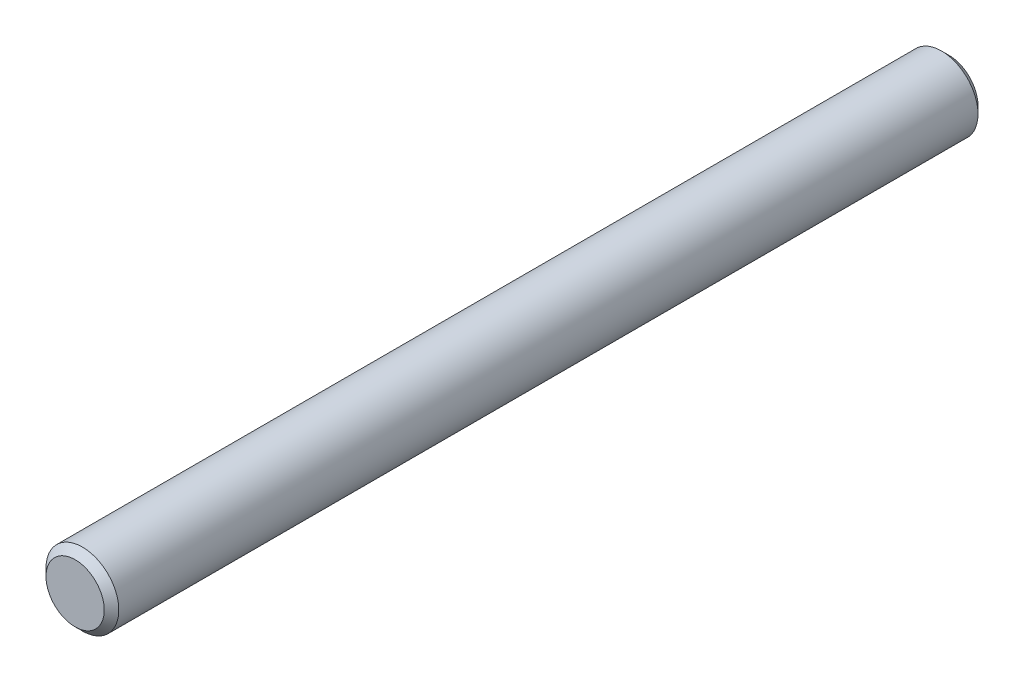
from build123d import *

# Parameters (mm, degrees)
SKETCH1_R      = 12.7
EXTRUDE1_DEPTH = 152.4
CHAMFER1_SIZE  = 2.54


with BuildPart() as part:
    # Sketch1 → Extrude1 (new, symmetric)
    with BuildSketch(Plane.XY):
        Circle(SKETCH1_R)
    extrude(amount=EXTRUDE1_DEPTH, both=True)

    # Chamfer1
    chamfer1_edges = [part.edges().sort_by_distance(p)[0] for p in [
        (-12.7, 0, -152.4),
        (-12.7, 0, 152.4),
    ]]
    chamfer(chamfer1_edges, length=CHAMFER1_SIZE)


solid = part.part
